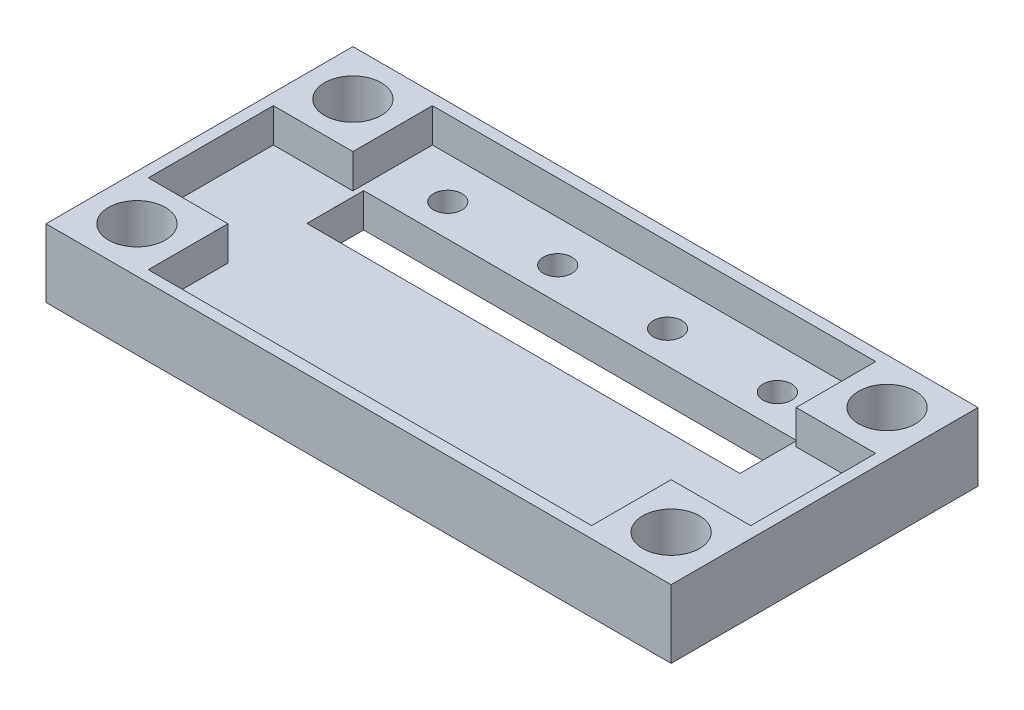
from build123d import *

# Parameters (mm, degrees)
SKETCH1_W                   = 55
SKETCH1_H                   = 27
SKETCH1_W_2                 = 38.1
SKETCH1_H_2                 = 5
BOTTOM_BASE_DEPTH           = 3
SKETCH3_R                   = 1.25
SENSOR_MOUNTING_HOLES_DEPTH = 3
SKETCH4_W                   = 55
SKETCH4_H                   = 27
OUTER_RIM_DEPTH             = 3
M4_BOLT_HOLES_D             = 5


with BuildPart() as part:
    # Sketch1 → Bottom Base (new body)
    with BuildSketch(Plane(origin=(0, 0, 0), x_dir=(1, 0, 0), z_dir=(0, 1, 0))):
        Rectangle(SKETCH1_W, SKETCH1_H)
        with Locations((0, 3.5)):
            Rectangle(SKETCH1_W_2, SKETCH1_H_2, mode=Mode.SUBTRACT)
    extrude(amount=BOTTOM_BASE_DEPTH)

    # Sketch3 → Sensor Mounting Holes (cut)
    with BuildSketch(Plane(origin=(0, 3, 0), x_dir=(1, 0, 0), z_dir=(0, 1, 0))):
        with Locations((-14.5, 8.85)):
            Circle(SKETCH3_R)
        with Locations((14.5, 8.85)):
            Circle(SKETCH3_R)
        with Locations((-4.83, 8.85)):
            Circle(SKETCH3_R)
        with Locations((4.84, 8.85)):
            Circle(SKETCH3_R)
    extrude(amount=-SENSOR_MOUNTING_HOLES_DEPTH, mode=Mode.SUBTRACT)

    # Sketch4 → Outer Rim (add)
    with BuildSketch(Plane(origin=(0, 3, 0), x_dir=(1, 0, 0), z_dir=(0, 1, 0))):
        Rectangle(SKETCH4_W, SKETCH4_H)
        Polygon((26.5, 5.5), (26.5, -5.5), (19.5, -5.5), (19.5, -12.5), (-19.5, -12.5), (-19.5, -5.5), (-26.5, -5.5), (-26.5, 5.5), (-19.5, 5.5), (-19.5, 12.5), (19.5, 12.5), (19.5, 5.5), align=None, mode=Mode.SUBTRACT)
    extrude(amount=OUTER_RIM_DEPTH)

    # M4 bolt holes (through all)
    with Locations(Plane(origin=(0, 6, 0), x_dir=(1, 0, 0), z_dir=(0, 1, 0))):
        with Locations((-23.5, 9.5), (-23.5, -9.5), (23.5, 9.5), (23.5, -9.5)):
            Hole(M4_BOLT_HOLES_D / 2)


solid = part.part
